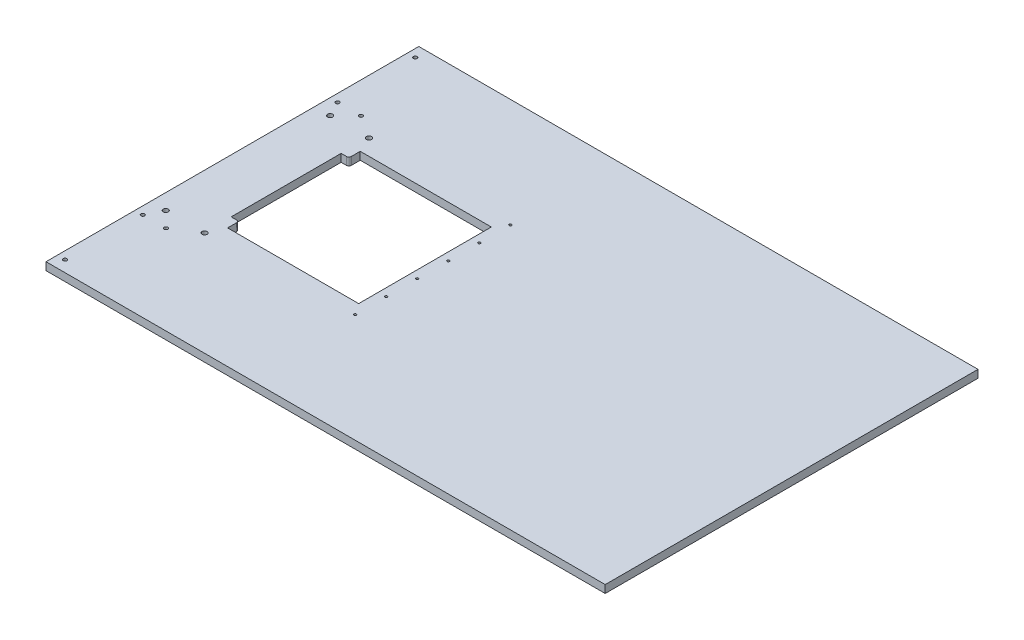
from build123d import *

# Parameters (mm, degrees)
SKETCH1_W           = 457.2
SKETCH1_H           = 304.8
BOSS_EXTRUDE1_DEPTH = 6.35
SKETCH2_R           = 2.063499937
SKETCH2_R_2         = 2.063500064
CUT_EXTRUDE1_DEPTH  = 275.816379606
CUT_EXTRUDE2_REACH  = 276.816
SKETCH5_R           = 1.500000048
CUT_EXTRUDE3_DEPTH  = 275.816379606
SKETCH6_R           = 1.000000032
CUT_EXTRUDE4_DEPTH  = 275.816379606


with BuildPart() as part:
    # Sketch1 → Boss-Extrude1 (new body)
    with BuildSketch(Plane(origin=(0, 0, 0), x_dir=(1, 0, 0), z_dir=(0, 1, 0))):
        Rectangle(SKETCH1_W, SKETCH1_H)
    extrude(amount=BOSS_EXTRUDE1_DEPTH)

    # Sketch2 → Cut-Extrude1 (cut, through all)
    with BuildSketch(Plane(origin=(0, 6.35, 0), x_dir=(1, 0, 0), z_dir=(0, 1, 0))):
        with Locations((-184.15, -67.197573915)):
            Circle(SKETCH2_R)
        with Locations((-215.9, -67.197573915)):
            Circle(SKETCH2_R_2)
        with Locations((-184.15, 67.197573915)):
            Circle(SKETCH2_R)
        with Locations((-215.9, 67.197573915)):
            Circle(SKETCH2_R_2)
    extrude(amount=-CUT_EXTRUDE1_DEPTH, mode=Mode.SUBTRACT)

    # Sketch4 → Cut-Extrude2 (cut, up to next)
    with BuildSketch(Plane(origin=(0, 6.35, 0), x_dir=(1, 0, 0), z_dir=(0, 1, 0)), mode=Mode.PRIVATE) as cut_extrude2_sk1:
        with BuildLine():
            Line((-184.658, 44.958), (-184.658, -44.958))
            Line((-184.658, -44.958), (-180.34, -44.958))
            ThreePointArc((-180.34, -44.958), (-178.903159021, -45.553159021), (-178.308, -46.99))
            Line((-178.308, -46.99), (-178.308, -54.229))
            Line((-178.308, -54.229), (-71.12, -54.229))
            Line((-71.12, -54.229), (-71.12, 54.229))
            Line((-71.12, 54.229), (-178.308, 54.229))
            Line((-178.308, 54.229), (-178.308, 46.99))
            ThreePointArc((-178.308, 46.99), (-178.903159021, 45.553159021), (-180.34, 44.958))
            Line((-180.34, 44.958), (-184.658, 44.958))
        make_face()
    cut_extrude2_tool1 = extrude(cut_extrude2_sk1.sketch, amount=-CUT_EXTRUDE2_REACH, mode=Mode.PRIVATE) & part.part
    add(cut_extrude2_tool1.solids().sort_by_distance((-127.379078, 6.35, 0))[0], mode=Mode.SUBTRACT)

    # Sketch5 → Cut-Extrude3 (cut, through all)
    with BuildSketch(Plane(origin=(0, 6.35, 0), x_dir=(1, 0, 0), z_dir=(0, 1, 0))):
        with Locations((-203.2, 79.629)):
            Circle(SKETCH5_R)
        with Locations((-222.25, 143.129)):
            Circle(SKETCH5_R)
        with Locations((-222.25, 79.629)):
            Circle(SKETCH5_R)
        with Locations((-203.2, -79.629)):
            Circle(SKETCH5_R)
        with Locations((-222.25, -79.629)):
            Circle(SKETCH5_R)
        with Locations((-222.25, -143.129)):
            Circle(SKETCH5_R)
    extrude(amount=-CUT_EXTRUDE3_DEPTH, mode=Mode.SUBTRACT)

    # Sketch6 → Cut-Extrude4 (cut, through all)
    with BuildSketch(Plane(origin=(0, 6.35, 0), x_dir=(1, 0, 0), z_dir=(0, 1, 0))):
        with Locations((-64.77, -12.7)):
            Circle(SKETCH6_R)
        with Locations((-64.77, 12.7)):
            Circle(SKETCH6_R)
        with Locations((-64.77, 38.1)):
            Circle(SKETCH6_R)
        with Locations((-64.77, 63.5)):
            Circle(SKETCH6_R)
        with Locations((-64.77, -63.5)):
            Circle(SKETCH6_R)
        with Locations((-64.77, -38.1)):
            Circle(SKETCH6_R)
    extrude(amount=-CUT_EXTRUDE4_DEPTH, mode=Mode.SUBTRACT)


solid = part.part
